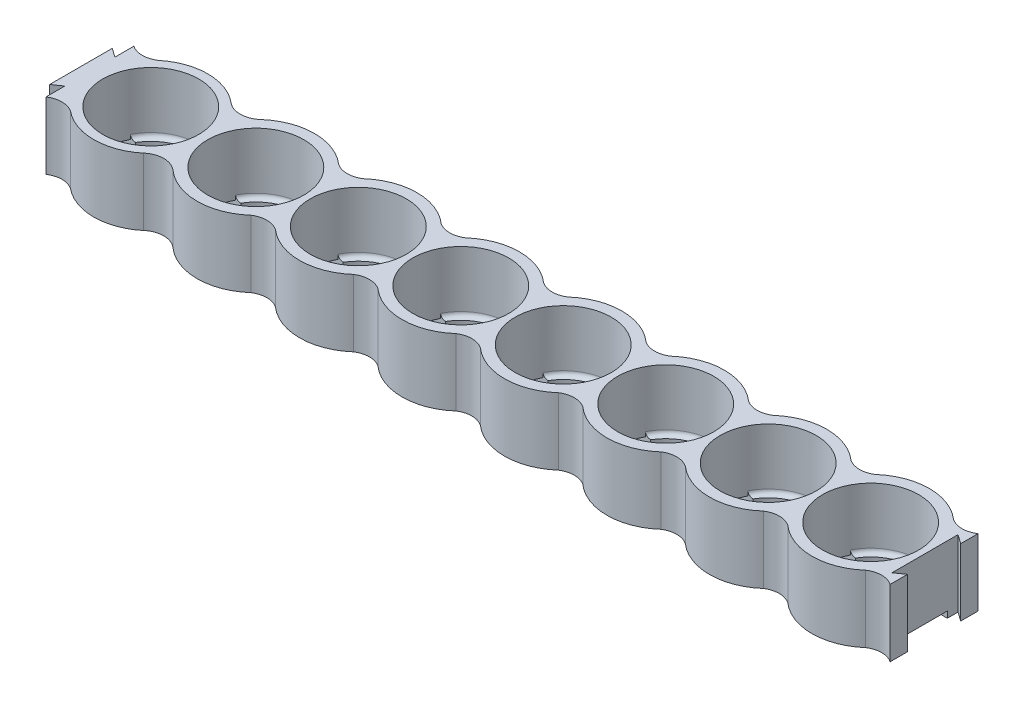
from build123d import *

# Parameters (mm, degrees)
SKETCH1_R           = 10.75
BOSS_EXTRUDE1_DEPTH = 15
SKETCH1_3_R         = 10.75
SKETCH1_3_R_2       = 9.75
BOSS_EXTRUDE2_DEPTH = 1.4
SKETCH2_W           = 188.767767663
SKETCH2_H           = 10
CUT_EXTRUDE1_DEPTH  = 1.4
FILLET1_R           = 1


with BuildPart() as part:
    # Sketch1 → Boss-Extrude1 (new body)
    with BuildSketch(Plane(origin=(0, 0, 0), x_dir=(1, 0, 0), z_dir=(0, 1, 0))):
        with BuildLine():
            Line((94.695926317, 9.815554342), (94.695926317, 5.955246745))
            Line((94.695926317, 5.955246745), (92.655174679, 7.384196425))
            Line((92.655174679, 7.384196425), (92.655174679, -7.384196425))
            Line((92.655174679, -7.384196425), (94.695926317, -5.955246745))
            Line((94.695926317, -5.955246745), (94.695926317, -9.815554342))
            ThreePointArc((94.695926317, -9.815554342), (91.958333333, -8.999521916), (89.22074035, -9.815554342))
            ThreePointArc((89.22074035, -9.815554342), (80.5, -13.129981694), (71.77925965, -9.815554342))
            ThreePointArc((71.77925965, -9.815554342), (69.041666667, -8.999521916), (66.304073683, -9.815554342))
            ThreePointArc((66.304073683, -9.815554342), (57.583333333, -13.129981694), (48.862592984, -9.815554342))
            ThreePointArc((48.862592984, -9.815554342), (46.125, -8.999521916), (43.387407016, -9.815554342))
            ThreePointArc((43.387407016, -9.815554342), (34.666666667, -13.129981694), (25.945926317, -9.815554342))
            ThreePointArc((25.945926317, -9.815554342), (23.208333333, -8.999521916), (20.47074035, -9.815554342))
            ThreePointArc((20.47074035, -9.815554342), (11.75, -13.129981694), (3.02925965, -9.815554342))
            ThreePointArc((3.02925965, -9.815554342), (0.291666667, -8.999521916), (-2.445926317, -9.815554342))
            ThreePointArc((-2.445926317, -9.815554342), (-11.166666667, -13.129981694), (-19.887407016, -9.815554342))
            ThreePointArc((-19.887407016, -9.815554342), (-22.625, -8.999521916), (-25.362592984, -9.815554342))
            ThreePointArc((-25.362592984, -9.815554342), (-34.083333333, -13.129981694), (-42.804073683, -9.815554342))
            ThreePointArc((-42.804073683, -9.815554342), (-45.541666667, -8.999521916), (-48.27925965, -9.815554342))
            ThreePointArc((-48.27925965, -9.815554342), (-57, -13.129981694), (-65.72074035, -9.815554342))
            ThreePointArc((-65.72074035, -9.815554342), (-69.041666667, -8.553394414), (-72.362592984, -9.815554342))
            ThreePointArc((-72.362592984, -9.815554342), (-80.5, -12.75), (-88.637407016, -9.815554342))
            ThreePointArc((-88.637407016, -9.815554342), (-91.375, -8.999521916), (-94.112592984, -9.815554342))
            Line((-94.112592984, -9.815554342), (-94.112592984, -5.599584924))
            Line((-94.112592984, -5.599584924), (-96.112592984, -7))
            Line((-96.112592984, -7), (-96.112592984, 7))
            Line((-96.112592984, 7), (-94.112592984, 5.599584924))
            Line((-94.112592984, 5.599584924), (-94.112592984, 9.815554342))
            ThreePointArc((-94.112592984, 9.815554342), (-91.375, 8.999521916), (-88.637407016, 9.815554342))
            ThreePointArc((-88.637407016, 9.815554342), (-80.5, 12.75), (-72.362592984, 9.815554342))
            ThreePointArc((-72.362592984, 9.815554342), (-69.041666667, 8.553394414), (-65.72074035, 9.815554342))
            ThreePointArc((-65.72074035, 9.815554342), (-57, 13.129981694), (-48.27925965, 9.815554342))
            ThreePointArc((-48.27925965, 9.815554342), (-45.541666667, 8.999521916), (-42.804073683, 9.815554342))
            ThreePointArc((-42.804073683, 9.815554342), (-34.083333333, 13.129981694), (-25.362592984, 9.815554342))
            ThreePointArc((-25.362592984, 9.815554342), (-22.625, 8.999521916), (-19.887407016, 9.815554342))
            ThreePointArc((-19.887407016, 9.815554342), (-11.166666667, 13.129981694), (-2.445926317, 9.815554342))
            ThreePointArc((-2.445926317, 9.815554342), (0.291666667, 8.999521916), (3.02925965, 9.815554342))
            ThreePointArc((3.02925965, 9.815554342), (11.75, 13.129981694), (20.47074035, 9.815554342))
            ThreePointArc((20.47074035, 9.815554342), (23.208333333, 8.999521916), (25.945926317, 9.815554342))
            ThreePointArc((25.945926317, 9.815554342), (34.666666667, 13.129981694), (43.387407016, 9.815554342))
            ThreePointArc((43.387407016, 9.815554342), (46.125, 8.999521916), (48.862592984, 9.815554342))
            ThreePointArc((48.862592984, 9.815554342), (57.583333333, 13.129981694), (66.304073683, 9.815554342))
            ThreePointArc((66.304073683, 9.815554342), (69.041666667, 8.999521916), (71.77925965, 9.815554342))
            ThreePointArc((71.77925965, 9.815554342), (80.5, 13.129981694), (89.22074035, 9.815554342))
            ThreePointArc((89.22074035, 9.815554342), (91.958333333, 8.999521916), (94.695926317, 9.815554342))
        make_face()
        with Locations(Location((-80.5, 0, 0), (0, 0, 270))):
            Circle(SKETCH1_R, mode=Mode.SUBTRACT)
        with Locations(Location((-57, 0, 0), (0, 0, 270))):
            Circle(SKETCH1_R, mode=Mode.SUBTRACT)
        with Locations(Location((-34.083333333, 0, 0), (0, 0, 270))):
            Circle(SKETCH1_R, mode=Mode.SUBTRACT)
        with Locations(Location((-11.166666667, 0, 0), (0, 0, 270))):
            Circle(SKETCH1_R, mode=Mode.SUBTRACT)
        with Locations(Location((11.75, 0, 0), (0, 0, 270))):
            Circle(SKETCH1_R, mode=Mode.SUBTRACT)
        with Locations(Location((34.666666667, 0, 0), (0, 0, 270))):
            Circle(SKETCH1_R, mode=Mode.SUBTRACT)
        with Locations(Location((57.583333333, 0, 0), (0, 0, 270))):
            Circle(SKETCH1_R, mode=Mode.SUBTRACT)
        with Locations(Location((80.5, 0, 0), (0, 0, 270))):
            Circle(SKETCH1_R, mode=Mode.SUBTRACT)
    extrude(amount=BOSS_EXTRUDE1_DEPTH)

    # Sketch1<3> → Boss-Extrude2 (add)
    # profile 1 of 8: a face of its own
    with BuildSketch(Plane(origin=(0, 0, 0), x_dir=(1, 0, 0), z_dir=(0, 1, 0))):
        with Locations(Location((-80.5, 0, 0), (0, 0, 270))):
            Circle(SKETCH1_3_R)
        with Locations(Location((-80.5, 0, 0), (0, 0, 270))):
            Circle(SKETCH1_3_R_2, mode=Mode.SUBTRACT)
    # profile 2 of 8: a face of its own
    with BuildSketch(Plane(origin=(0, 0, 0), x_dir=(1, 0, 0), z_dir=(0, 1, 0))):
        with Locations(Location((-57, 0, 0), (0, 0, 270))):
            Circle(SKETCH1_3_R)
        with Locations(Location((-57, 0, 0), (0, 0, 270))):
            Circle(SKETCH1_3_R_2, mode=Mode.SUBTRACT)
    # profile 3 of 8: a face of its own
    with BuildSketch(Plane(origin=(0, 0, 0), x_dir=(1, 0, 0), z_dir=(0, 1, 0))):
        with Locations(Location((-34.083333333, 0, 0), (0, 0, 270))):
            Circle(SKETCH1_3_R)
        with Locations(Location((-34.083333333, 0, 0), (0, 0, 270))):
            Circle(SKETCH1_3_R_2, mode=Mode.SUBTRACT)
    # profile 4 of 8: a face of its own
    with BuildSketch(Plane(origin=(0, 0, 0), x_dir=(1, 0, 0), z_dir=(0, 1, 0))):
        with Locations(Location((-11.166666667, 0, 0), (0, 0, 270))):
            Circle(SKETCH1_3_R)
        with Locations(Location((-11.166666667, 0, 0), (0, 0, 270))):
            Circle(SKETCH1_3_R_2, mode=Mode.SUBTRACT)
    # profile 5 of 8: a face of its own
    with BuildSketch(Plane(origin=(0, 0, 0), x_dir=(1, 0, 0), z_dir=(0, 1, 0))):
        with Locations(Location((11.75, 0, 0), (0, 0, 270))):
            Circle(SKETCH1_3_R)
        with Locations(Location((11.75, 0, 0), (0, 0, 270))):
            Circle(SKETCH1_3_R_2, mode=Mode.SUBTRACT)
    # profile 6 of 8: a face of its own
    with BuildSketch(Plane(origin=(0, 0, 0), x_dir=(1, 0, 0), z_dir=(0, 1, 0))):
        with Locations(Location((34.666666667, 0, 0), (0, 0, 270))):
            Circle(SKETCH1_3_R)
        with Locations(Location((34.666666667, 0, 0), (0, 0, 270))):
            Circle(SKETCH1_3_R_2, mode=Mode.SUBTRACT)
    # profile 7 of 8: a face of its own
    with BuildSketch(Plane(origin=(0, 0, 0), x_dir=(1, 0, 0), z_dir=(0, 1, 0))):
        with Locations(Location((57.583333333, 0, 0), (0, 0, 270))):
            Circle(SKETCH1_3_R)
        with Locations(Location((57.583333333, 0, 0), (0, 0, 270))):
            Circle(SKETCH1_3_R_2, mode=Mode.SUBTRACT)
    # profile 8 of 8: a face of its own
    with BuildSketch(Plane(origin=(0, 0, 0), x_dir=(1, 0, 0), z_dir=(0, 1, 0))):
        with Locations(Location((80.5, 0, 0), (0, 0, 270))):
            Circle(SKETCH1_3_R)
        with Locations(Location((80.5, 0, 0), (0, 0, 270))):
            Circle(SKETCH1_3_R_2, mode=Mode.SUBTRACT)
    extrude(amount=BOSS_EXTRUDE2_DEPTH)

    # Sketch2 → Cut-Extrude1 (cut)
    with BuildSketch(Plane.XZ):
        with Locations((-1.728709152, 0)):
            Rectangle(SKETCH2_W, SKETCH2_H)
    extrude(amount=-CUT_EXTRUDE1_DEPTH, mode=Mode.SUBTRACT)

    # Fillet1
    # the kernel refuses this fillet: 1 mm, written as the material it adds along each edge
    with BuildSketch(Plane(origin=(80.5, 1.4, 0), x_dir=(0, 0, 1), z_dir=(-1, 0, 0))) as fillet1_piece_1_section:
        with BuildLine():
            CenterArc((10.75 - FILLET1_R, FILLET1_R), FILLET1_R, 270, 90)
            Line((10.75 - FILLET1_R, 0), (10.75, 0))
            Line((10.75, 0), (10.75, FILLET1_R))
        make_face()
    fillet1_piece_1 = revolve(axis=Axis((80.5, 1.4, 0), (0, 1, 0)), revolution_arc=75.609415175, mode=Mode.PRIVATE)
    fillet1_piece_1 = split(fillet1_piece_1, bisect_by=Plane(origin=(80.5, 1.4, 5), z_dir=(0, 0, 1)), keep=Keep.TOP, mode=Mode.PRIVATE)
    add(fillet1_piece_1)
    with BuildSketch(Plane(origin=(80.5, 1.4, 0), x_dir=(0.9686573755765139, 0, -0.2484006617165512), z_dir=(0.2484006617165512, 0, 0.9686573755765139))) as fillet1_piece_2_section:
        with BuildLine():
            CenterArc((10.75 - FILLET1_R, FILLET1_R), FILLET1_R, 270, 90)
            Line((10.75 - FILLET1_R, 0), (10.75, 0))
            Line((10.75, 0), (10.75, FILLET1_R))
        make_face()
    fillet1_piece_2 = revolve(axis=Axis((80.5, 1.4, 0), (0, 1, 0)), revolution_arc=151.234216499, mode=Mode.PRIVATE)
    fillet1_piece_2 = split(fillet1_piece_2, bisect_by=Plane(origin=(80.5, 1.4, -5), z_dir=(0, 0, -1)), keep=Keep.TOP, mode=Mode.PRIVATE)
    add(fillet1_piece_2)
    with BuildSketch(Plane(origin=(-80.5, 1.4, 0), x_dir=(0, 0, 1), z_dir=(-1, 0, 0))) as fillet1_piece_3_section:
        with BuildLine():
            CenterArc((10.75 - FILLET1_R, FILLET1_R), FILLET1_R, 270, 90)
            Line((10.75, FILLET1_R), (10.75, 0))
            Line((10.75, 0), (10.75 - FILLET1_R, 0))
        make_face()
    fillet1_piece_3 = revolve(axis=Axis((-80.5, 1.4, 0), (0, 1, 0)), revolution_arc=75.609415175, mode=Mode.PRIVATE)
    fillet1_piece_3 = split(fillet1_piece_3, bisect_by=Plane(origin=(-80.5, 1.4, 5), z_dir=(0, 0, 1)), keep=Keep.TOP, mode=Mode.PRIVATE)
    add(fillet1_piece_3)
    with BuildSketch(Plane(origin=(-80.5, 1.4, 0), x_dir=(0.9686573755765144, 0, -0.2484006617165496), z_dir=(0.2484006617165496, 0, 0.9686573755765144))) as fillet1_piece_4_section:
        with BuildLine():
            CenterArc((10.75 - FILLET1_R, FILLET1_R), FILLET1_R, 270, 90)
            Line((10.75, FILLET1_R), (10.75, 0))
            Line((10.75, 0), (10.75 - FILLET1_R, 0))
        make_face()
    fillet1_piece_4 = revolve(axis=Axis((-80.5, 1.4, 0), (0, 1, 0)), revolution_arc=151.234216499, mode=Mode.PRIVATE)
    fillet1_piece_4 = split(fillet1_piece_4, bisect_by=Plane(origin=(-80.5, 1.4, -5), z_dir=(0, 0, -1)), keep=Keep.TOP, mode=Mode.PRIVATE)
    add(fillet1_piece_4)
    with BuildSketch(Plane(origin=(-57, 1.4, 0), x_dir=(-0.9686240142151771, 0, 0.24853072060748604), z_dir=(-0.24853072060748604, 0, -0.9686240142151771))) as fillet1_piece_5_section:
        with BuildLine():
            CenterArc((10.75 - FILLET1_R, FILLET1_R), FILLET1_R, 270, 90)
            Line((10.75, FILLET1_R), (10.75, 0))
            Line((10.75, 0), (10.75 - FILLET1_R, 0))
        make_face()
    fillet1_piece_5 = revolve(axis=Axis((-57, 1.4, 0), (0, 1, 0)), revolution_arc=75.609415175, mode=Mode.PRIVATE)
    fillet1_piece_5 = split(fillet1_piece_5, bisect_by=Plane(origin=(-57, 1.4, 5), z_dir=(0, 0, 1)), keep=Keep.TOP, mode=Mode.PRIVATE)
    add(fillet1_piece_5)
    with BuildSketch(Plane(origin=(-57, 1.4, 0), x_dir=(0.9686573755765142, 0, -0.24840066171654995), z_dir=(0.24840066171654995, 0, 0.9686573755765142))) as fillet1_piece_6_section:
        with BuildLine():
            CenterArc((10.75 - FILLET1_R, FILLET1_R), FILLET1_R, 270, 90)
            Line((10.75, FILLET1_R), (10.75, 0))
            Line((10.75, 0), (10.75 - FILLET1_R, 0))
        make_face()
    fillet1_piece_6 = revolve(axis=Axis((-57, 1.4, 0), (0, 1, 0)), revolution_arc=151.234216499, mode=Mode.PRIVATE)
    fillet1_piece_6 = split(fillet1_piece_6, bisect_by=Plane(origin=(-57, 1.4, -5), z_dir=(0, 0, -1)), keep=Keep.TOP, mode=Mode.PRIVATE)
    add(fillet1_piece_6)
    with BuildSketch(Plane(origin=(-34.083333333, 1.4, 0), x_dir=(0, 0, 1), z_dir=(-1, 0, 0))) as fillet1_piece_7_section:
        with BuildLine():
            CenterArc((10.75 - FILLET1_R, FILLET1_R), FILLET1_R, 270, 90)
            Line((10.75, FILLET1_R), (10.75, 0))
            Line((10.75, 0), (10.75 - FILLET1_R, 0))
        make_face()
    fillet1_piece_7 = revolve(axis=Axis((-34.083333333, 1.4, 0), (0, 1, 0)), revolution_arc=75.609415175, mode=Mode.PRIVATE)
    fillet1_piece_7 = split(fillet1_piece_7, bisect_by=Plane(origin=(-34.083333333, 1.4, 5), z_dir=(0, 0, 1)), keep=Keep.TOP, mode=Mode.PRIVATE)
    add(fillet1_piece_7)
    with BuildSketch(Plane(origin=(-34.083333333, 1.4, 0), x_dir=(0.9686573755765144, 0, -0.24840066171654906), z_dir=(0.24840066171654906, 0, 0.9686573755765144))) as fillet1_piece_8_section:
        with BuildLine():
            CenterArc((10.75 - FILLET1_R, FILLET1_R), FILLET1_R, 270, 90)
            Line((10.75, FILLET1_R), (10.75, 0))
            Line((10.75, 0), (10.75 - FILLET1_R, 0))
        make_face()
    fillet1_piece_8 = revolve(axis=Axis((-34.083333333, 1.4, 0), (0, 1, 0)), revolution_arc=151.234216499, mode=Mode.PRIVATE)
    fillet1_piece_8 = split(fillet1_piece_8, bisect_by=Plane(origin=(-34.083333333, 1.4, -5), z_dir=(0, 0, -1)), keep=Keep.TOP, mode=Mode.PRIVATE)
    add(fillet1_piece_8)
    with BuildSketch(Plane(origin=(-11.166666667, 1.4, 0), x_dir=(0, 0, 1), z_dir=(-1, 0, 0))) as fillet1_piece_9_section:
        with BuildLine():
            CenterArc((10.75 - FILLET1_R, FILLET1_R), FILLET1_R, 270, 90)
            Line((10.75, FILLET1_R), (10.75, 0))
            Line((10.75, 0), (10.75 - FILLET1_R, 0))
        make_face()
    fillet1_piece_9 = revolve(axis=Axis((-11.166666667, 1.4, 0), (0, 1, 0)), revolution_arc=75.609415175, mode=Mode.PRIVATE)
    fillet1_piece_9 = split(fillet1_piece_9, bisect_by=Plane(origin=(-11.166666667, 1.4, 5), z_dir=(0, 0, 1)), keep=Keep.TOP, mode=Mode.PRIVATE)
    add(fillet1_piece_9)
    with BuildSketch(Plane(origin=(-11.166666667, 1.4, 0), x_dir=(0.9686573755765144, 0, -0.2484006617165495), z_dir=(0.2484006617165495, 0, 0.9686573755765144))) as fillet1_piece_10_section:
        with BuildLine():
            CenterArc((10.75 - FILLET1_R, FILLET1_R), FILLET1_R, 270, 90)
            Line((10.75, FILLET1_R), (10.75, 0))
            Line((10.75, 0), (10.75 - FILLET1_R, 0))
        make_face()
    fillet1_piece_10 = revolve(axis=Axis((-11.166666667, 1.4, 0), (0, 1, 0)), revolution_arc=151.234216499, mode=Mode.PRIVATE)
    fillet1_piece_10 = split(fillet1_piece_10, bisect_by=Plane(origin=(-11.166666667, 1.4, -5), z_dir=(0, 0, -1)), keep=Keep.TOP, mode=Mode.PRIVATE)
    add(fillet1_piece_10)
    with BuildSketch(Plane(origin=(11.75, 1.4, 0), x_dir=(0.9686573755765144, 0, -0.2484006617165495), z_dir=(0.2484006617165495, 0, 0.9686573755765144))) as fillet1_piece_11_section:
        with BuildLine():
            CenterArc((10.75 - FILLET1_R, FILLET1_R), FILLET1_R, 270, 90)
            Line((10.75, FILLET1_R), (10.75, 0))
            Line((10.75, 0), (10.75 - FILLET1_R, 0))
        make_face()
    fillet1_piece_11 = revolve(axis=Axis((11.75, 1.4, 0), (0, 1, 0)), revolution_arc=151.234216499, mode=Mode.PRIVATE)
    fillet1_piece_11 = split(fillet1_piece_11, bisect_by=Plane(origin=(11.75, 1.4, -5), z_dir=(0, 0, -1)), keep=Keep.TOP, mode=Mode.PRIVATE)
    add(fillet1_piece_11)
    with BuildSketch(Plane(origin=(11.75, 1.4, 0), x_dir=(0, 0, 1), z_dir=(-1, 0, 0))) as fillet1_piece_12_section:
        with BuildLine():
            CenterArc((10.75 - FILLET1_R, FILLET1_R), FILLET1_R, 270, 90)
            Line((10.75, FILLET1_R), (10.75, 0))
            Line((10.75, 0), (10.75 - FILLET1_R, 0))
        make_face()
    fillet1_piece_12 = revolve(axis=Axis((11.75, 1.4, 0), (0, 1, 0)), revolution_arc=75.609415175, mode=Mode.PRIVATE)
    fillet1_piece_12 = split(fillet1_piece_12, bisect_by=Plane(origin=(11.75, 1.4, 5), z_dir=(0, 0, 1)), keep=Keep.TOP, mode=Mode.PRIVATE)
    add(fillet1_piece_12)
    with BuildSketch(Plane(origin=(34.666666667, 1.4, 0), x_dir=(-0.9686240142151771, 0, 0.24853072060748604), z_dir=(-0.24853072060748604, 0, -0.9686240142151771))) as fillet1_piece_13_section:
        with BuildLine():
            CenterArc((10.75 - FILLET1_R, FILLET1_R), FILLET1_R, 270, 90)
            Line((10.75, FILLET1_R), (10.75, 0))
            Line((10.75, 0), (10.75 - FILLET1_R, 0))
        make_face()
    fillet1_piece_13 = revolve(axis=Axis((34.666666667, 1.4, 0), (0, 1, 0)), revolution_arc=75.609415175, mode=Mode.PRIVATE)
    fillet1_piece_13 = split(fillet1_piece_13, bisect_by=Plane(origin=(34.666666667, 1.4, 5), z_dir=(0, 0, 1)), keep=Keep.TOP, mode=Mode.PRIVATE)
    add(fillet1_piece_13)
    with BuildSketch(Plane(origin=(34.666666667, 1.4, 0), x_dir=(0.9686573755765144, 0, -0.24840066171654943), z_dir=(0.24840066171654943, 0, 0.9686573755765144))) as fillet1_piece_14_section:
        with BuildLine():
            CenterArc((10.75 - FILLET1_R, FILLET1_R), FILLET1_R, 270, 90)
            Line((10.75, FILLET1_R), (10.75, 0))
            Line((10.75, 0), (10.75 - FILLET1_R, 0))
        make_face()
    fillet1_piece_14 = revolve(axis=Axis((34.666666667, 1.4, 0), (0, 1, 0)), revolution_arc=151.234216499, mode=Mode.PRIVATE)
    fillet1_piece_14 = split(fillet1_piece_14, bisect_by=Plane(origin=(34.666666667, 1.4, -5), z_dir=(0, 0, -1)), keep=Keep.TOP, mode=Mode.PRIVATE)
    add(fillet1_piece_14)
    with BuildSketch(Plane(origin=(57.583333333, 1.4, 0), x_dir=(0.9686573755765144, 0, -0.24840066171654943), z_dir=(0.24840066171654943, 0, 0.9686573755765144))) as fillet1_piece_15_section:
        with BuildLine():
            CenterArc((10.75 - FILLET1_R, FILLET1_R), FILLET1_R, 270, 90)
            Line((10.75, FILLET1_R), (10.75, 0))
            Line((10.75, 0), (10.75 - FILLET1_R, 0))
        make_face()
    fillet1_piece_15 = revolve(axis=Axis((57.583333333, 1.4, 0), (0, 1, 0)), revolution_arc=151.234216499, mode=Mode.PRIVATE)
    fillet1_piece_15 = split(fillet1_piece_15, bisect_by=Plane(origin=(57.583333333, 1.4, -5), z_dir=(0, 0, -1)), keep=Keep.TOP, mode=Mode.PRIVATE)
    add(fillet1_piece_15)
    with BuildSketch(Plane(origin=(57.583333333, 1.4, 0), x_dir=(0, 0, 1), z_dir=(-1, 0, 0))) as fillet1_piece_16_section:
        with BuildLine():
            CenterArc((10.75 - FILLET1_R, FILLET1_R), FILLET1_R, 270, 90)
            Line((10.75, FILLET1_R), (10.75, 0))
            Line((10.75, 0), (10.75 - FILLET1_R, 0))
        make_face()
    fillet1_piece_16 = revolve(axis=Axis((57.583333333, 1.4, 0), (0, 1, 0)), revolution_arc=75.609415175, mode=Mode.PRIVATE)
    fillet1_piece_16 = split(fillet1_piece_16, bisect_by=Plane(origin=(57.583333333, 1.4, 5), z_dir=(0, 0, 1)), keep=Keep.TOP, mode=Mode.PRIVATE)
    add(fillet1_piece_16)
    with BuildSketch(Plane(origin=(57.583333333, 1.4, 0), x_dir=(-0.9686240142151771, 0, 0.24853072060748604), z_dir=(-0.24853072060748604, 0, -0.9686240142151771))) as fillet1_piece_17_section:
        with BuildLine():
            CenterArc((10.75 - FILLET1_R, FILLET1_R), FILLET1_R, 270, 90)
            Line((10.75, FILLET1_R), (10.75, 0))
            Line((10.75, 0), (10.75 - FILLET1_R, 0))
        make_face()
    fillet1_piece_17 = revolve(axis=Axis((57.583333333, 1.4, 0), (0, 1, 0)), revolution_arc=75.609415175, mode=Mode.PRIVATE)
    fillet1_piece_17 = split(fillet1_piece_17, bisect_by=Plane(origin=(57.583333333, 1.4, 5), z_dir=(0, 0, 1)), keep=Keep.TOP, mode=Mode.PRIVATE)
    add(fillet1_piece_17)
    with BuildSketch(Plane(origin=(34.666666667, 1.4, 0), x_dir=(0, 0, 1), z_dir=(-1, 0, 0))) as fillet1_piece_18_section:
        with BuildLine():
            CenterArc((10.75 - FILLET1_R, FILLET1_R), FILLET1_R, 270, 90)
            Line((10.75, FILLET1_R), (10.75, 0))
            Line((10.75, 0), (10.75 - FILLET1_R, 0))
        make_face()
    fillet1_piece_18 = revolve(axis=Axis((34.666666667, 1.4, 0), (0, 1, 0)), revolution_arc=75.609415175, mode=Mode.PRIVATE)
    fillet1_piece_18 = split(fillet1_piece_18, bisect_by=Plane(origin=(34.666666667, 1.4, 5), z_dir=(0, 0, 1)), keep=Keep.TOP, mode=Mode.PRIVATE)
    add(fillet1_piece_18)
    with BuildSketch(Plane(origin=(11.75, 1.4, 0), x_dir=(-0.9686240142151772, 0, 0.248530720607486), z_dir=(-0.248530720607486, 0, -0.9686240142151772))) as fillet1_piece_19_section:
        with BuildLine():
            CenterArc((10.75 - FILLET1_R, FILLET1_R), FILLET1_R, 270, 90)
            Line((10.75, FILLET1_R), (10.75, 0))
            Line((10.75, 0), (10.75 - FILLET1_R, 0))
        make_face()
    fillet1_piece_19 = revolve(axis=Axis((11.75, 1.4, 0), (0, 1, 0)), revolution_arc=75.609415175, mode=Mode.PRIVATE)
    fillet1_piece_19 = split(fillet1_piece_19, bisect_by=Plane(origin=(11.75, 1.4, 5), z_dir=(0, 0, 1)), keep=Keep.TOP, mode=Mode.PRIVATE)
    add(fillet1_piece_19)
    with BuildSketch(Plane(origin=(-11.166666667, 1.4, 0), x_dir=(-0.9686240142151771, 0, 0.24853072060748604), z_dir=(-0.24853072060748604, 0, -0.9686240142151771))) as fillet1_piece_20_section:
        with BuildLine():
            CenterArc((10.75 - FILLET1_R, FILLET1_R), FILLET1_R, 270, 90)
            Line((10.75, FILLET1_R), (10.75, 0))
            Line((10.75, 0), (10.75 - FILLET1_R, 0))
        make_face()
    fillet1_piece_20 = revolve(axis=Axis((-11.166666667, 1.4, 0), (0, 1, 0)), revolution_arc=75.609415175, mode=Mode.PRIVATE)
    fillet1_piece_20 = split(fillet1_piece_20, bisect_by=Plane(origin=(-11.166666667, 1.4, 5), z_dir=(0, 0, 1)), keep=Keep.TOP, mode=Mode.PRIVATE)
    add(fillet1_piece_20)
    with BuildSketch(Plane(origin=(-34.083333333, 1.4, 0), x_dir=(-0.9686240142151771, 0, 0.24853072060748604), z_dir=(-0.24853072060748604, 0, -0.9686240142151771))) as fillet1_piece_21_section:
        with BuildLine():
            CenterArc((10.75 - FILLET1_R, FILLET1_R), FILLET1_R, 270, 90)
            Line((10.75, FILLET1_R), (10.75, 0))
            Line((10.75, 0), (10.75 - FILLET1_R, 0))
        make_face()
    fillet1_piece_21 = revolve(axis=Axis((-34.083333333, 1.4, 0), (0, 1, 0)), revolution_arc=75.609415175, mode=Mode.PRIVATE)
    fillet1_piece_21 = split(fillet1_piece_21, bisect_by=Plane(origin=(-34.083333333, 1.4, 5), z_dir=(0, 0, 1)), keep=Keep.TOP, mode=Mode.PRIVATE)
    add(fillet1_piece_21)
    with BuildSketch(Plane(origin=(-57, 1.4, 0), x_dir=(0, 0, 1), z_dir=(-1, 0, 0))) as fillet1_piece_22_section:
        with BuildLine():
            CenterArc((10.75 - FILLET1_R, FILLET1_R), FILLET1_R, 270, 90)
            Line((10.75, FILLET1_R), (10.75, 0))
            Line((10.75, 0), (10.75 - FILLET1_R, 0))
        make_face()
    fillet1_piece_22 = revolve(axis=Axis((-57, 1.4, 0), (0, 1, 0)), revolution_arc=75.609415175, mode=Mode.PRIVATE)
    fillet1_piece_22 = split(fillet1_piece_22, bisect_by=Plane(origin=(-57, 1.4, 5), z_dir=(0, 0, 1)), keep=Keep.TOP, mode=Mode.PRIVATE)
    add(fillet1_piece_22)
    with BuildSketch(Plane(origin=(-80.5, 1.4, 0), x_dir=(-0.9686240142151775, 0, 0.2485307206074851), z_dir=(-0.2485307206074851, 0, -0.9686240142151775))) as fillet1_piece_23_section:
        with BuildLine():
            CenterArc((10.75 - FILLET1_R, FILLET1_R), FILLET1_R, 270, 90)
            Line((10.75, FILLET1_R), (10.75, 0))
            Line((10.75, 0), (10.75 - FILLET1_R, 0))
        make_face()
    fillet1_piece_23 = revolve(axis=Axis((-80.5, 1.4, 0), (0, 1, 0)), revolution_arc=75.609415175, mode=Mode.PRIVATE)
    fillet1_piece_23 = split(fillet1_piece_23, bisect_by=Plane(origin=(-80.5, 1.4, 5), z_dir=(0, 0, 1)), keep=Keep.TOP, mode=Mode.PRIVATE)
    add(fillet1_piece_23)
    with BuildSketch(Plane(origin=(80.5, 1.4, 0), x_dir=(-0.9686240142151777, 0, 0.24853072060748344), z_dir=(-0.24853072060748344, 0, -0.9686240142151777))) as fillet1_piece_24_section:
        with BuildLine():
            CenterArc((10.75 - FILLET1_R, FILLET1_R), FILLET1_R, 270, 90)
            Line((10.75 - FILLET1_R, 0), (10.75, 0))
            Line((10.75, 0), (10.75, FILLET1_R))
        make_face()
    fillet1_piece_24 = revolve(axis=Axis((80.5, 1.4, 0), (0, 1, 0)), revolution_arc=75.609415175, mode=Mode.PRIVATE)
    fillet1_piece_24 = split(fillet1_piece_24, bisect_by=Plane(origin=(80.5, 1.4, 5), z_dir=(0, 0, 1)), keep=Keep.TOP, mode=Mode.PRIVATE)
    add(fillet1_piece_24)


solid = part.part
